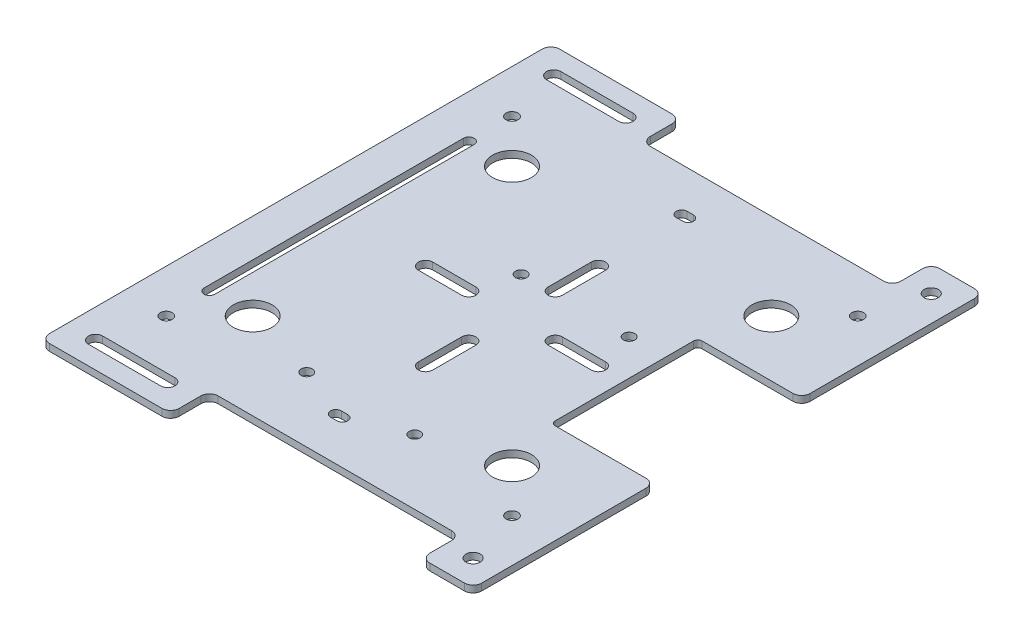
from build123d import *

# Parameters (mm, degrees)
BOSS_EXTRUDE1_DEPTH       = 1.5875
CUT_EXTRUDE1_DEPTH        = 5
SKETCH4_R                 = 1.375
CUT_EXTRUDE2_DEPTH        = 5
CUT_EXTRUDE4_DEPTH        = 5
CUT_EXTRUDE6_DEPTH        = 5
CIRPATTERN1_COUNT         = 4
CIRPATTERN4_COUNT         = 4
F_2_5MM_DOWEL_HOLE1_D     = 2.6
F_2_5MM_DOWEL_HOLE2_D     = 2.6
F_9_0_9_DIAMETER_HOLE1_D  = 9
CIRPATTERN5_COUNT         = 4
FILLET1_R                 = 2
F_2_5MM_DOWEL_HOLE3_D     = 3.3
F_2_5MM_DOWEL_SLOT1_DEPTH = 1.5875
SKETCH19_W                = 24
SKETCH19_H                = 34
CUT_EXTRUDE7_DEPTH        = 10
FILLET2_R                 = 2
FILLET3_R                 = 1


# Read off the part's stored shape, not the designer's step: Ø2.5mm Dowel Slot1
with BuildPart() as part:
    # Sketch2 → Boss-Extrude1 (new body)
    with BuildSketch(Plane(origin=(0, 0, 0), x_dir=(1, 0, 0), z_dir=(0, 1, 0))):
        Polygon((30, 0), (88, 0), (88, -9), (100, -9), (100, 0), (100, 100), (100, 109), (88, 109), (88, 100), (30, 100), (30, 109), (0, 109), (0, 100), (0, 0), (0, -9), (30, -9), align=None)
    extrude(amount=BOSS_EXTRUDE1_DEPTH)

    # Sketch3 → Cut-Extrude1 (cut)
    with BuildSketch(Plane(origin=(0, 1.5875, 0), x_dir=(1, 0, 0), z_dir=(0, 1, 0))):
        with BuildLine():
            Line((11.25, 80), (11.25, 20))
            ThreePointArc((11.25, 20), (10, 18.75), (8.75, 20))
            Line((8.75, 20), (8.75, 80))
            ThreePointArc((8.75, 80), (10, 81.25), (11.25, 80))
        make_face()
    extrude(amount=-CUT_EXTRUDE1_DEPTH, mode=Mode.SUBTRACT)

    # Sketch4 → Cut-Extrude2 (cut)
    with BuildSketch(Plane(origin=(0, 1.5875, 0), x_dir=(1, 0, 0), z_dir=(0, 1, 0))):
        with Locations(Location((10, 10, 0), (0, 0, 270))):
            Circle(SKETCH4_R)
    cut_extrude2 = extrude(amount=-CUT_EXTRUDE2_DEPTH, mode=Mode.SUBTRACT)

    # Sketch6 → Cut-Extrude4 (cut)
    with BuildSketch(Plane(origin=(0, 1.5875, 0), x_dir=(1, 0, 0), z_dir=(0, 1, 0))):
        with BuildLine():
            Line((49.25, 11.25), (50.75, 11.25))
            ThreePointArc((50.75, 11.25), (52, 10), (50.75, 8.75))
            Line((50.75, 8.75), (49.25, 8.75))
            ThreePointArc((49.25, 8.75), (48, 10), (49.25, 11.25))
        make_face()
    cut_extrude4 = extrude(amount=-CUT_EXTRUDE4_DEPTH, mode=Mode.SUBTRACT)

    # Sketch8 → Cut-Extrude6 (cut)
    with BuildSketch(Plane(origin=(0, 1.5875, 0), x_dir=(1, 0, 0), z_dir=(0, 1, 0))):
        with BuildLine():
            Line((30, 51.65), (40, 51.65))
            ThreePointArc((40, 51.65), (41.65, 50), (40, 48.35))
            Line((40, 48.35), (30, 48.35))
            ThreePointArc((30, 48.35), (28.35, 50), (30, 51.65))
        make_face()
    cut_extrude6 = extrude(amount=-CUT_EXTRUDE6_DEPTH, mode=Mode.SUBTRACT)

    # CirPattern1: Cut-Extrude6 ×4 about axis
    cirpattern1_axis = Axis((50, 0, -50), (0, 1, 0))
    for i in range(1, CIRPATTERN1_COUNT):
        add(cut_extrude6.rotate(cirpattern1_axis, i * 360 / CIRPATTERN1_COUNT), mode=Mode.SUBTRACT)

    # CirPattern4: Cut-Extrude2 ×4 about axis
    cirpattern4_axis = Axis((50, 0, -50), (0, 1, 0))
    for i in range(1, CIRPATTERN4_COUNT):
        add(cut_extrude2.rotate(cirpattern4_axis, i * 360 / CIRPATTERN4_COUNT), mode=Mode.SUBTRACT)

    # Mirror6: Cut-Extrude4 across plane
    add(cut_extrude4.mirror(Plane(origin=(0, 0, -50), x_dir=(1, 0, 0), z_dir=(0, 0, -1))), mode=Mode.SUBTRACT)

    # Ø2.5mm Dowel Hole1 (through all)
    with Locations(Plane(origin=(0, 1.5875, 0), x_dir=(1, 0, 0), z_dir=(0, 1, 0))):
        with Locations((62.5, 15), (37.5, 15)):
            Hole(F_2_5MM_DOWEL_HOLE1_D / 2)

    # Ø2.5mm Dowel Hole2 (through all)
    with Locations(Plane(origin=(0, 1.5875, 0), x_dir=(1, 0, 0), z_dir=(0, 1, 0))):
        with Locations((42.7, 59.4), (67.7, 59.4)):
            Hole(F_2_5MM_DOWEL_HOLE2_D / 2)

    # Ø9.0 (9) Diameter Hole1 (through all)
    with Locations(Plane(origin=(0, 1.5875, 0), x_dir=(1, 0, 0), z_dir=(0, 1, 0))):
        with Locations((80, 20)):
            f_9_0_9_diameter_hole1 = Hole(F_9_0_9_DIAMETER_HOLE1_D / 2)

    # CirPattern5: Ø9.0 (9) Diameter Hole1 ×4 about axis
    cirpattern5_axis = Axis((50, 0, -50), (0, 1, 0))
    for i in range(1, CIRPATTERN5_COUNT):
        add(f_9_0_9_diameter_hole1.rotate(cirpattern5_axis, i * 360 / CIRPATTERN5_COUNT), mode=Mode.SUBTRACT)

    # Fillet1
    fillet1_edges = [part.edges().sort_by_distance(p)[0] for p in [
        (30, 0.79375, 0),
        (30, 0.79375, 9),
        (0, 0.79375, 9),
        (0, 0.79375, -109),
        (30, 0.79375, -109),
        (30, 0.79375, -100),
        (88, 0.79375, -100),
        (88, 0.79375, -109),
        (100, 0.79375, -109),
        (100, 0.79375, 9),
        (88, 0.79375, 9),
        (88, 0.79375, 0),
    ]]
    fillet(fillet1_edges, radius=FILLET1_R)

    # Ø2.5mm Dowel Hole3 (through all)
    with Locations(Plane(origin=(0, 1.5875, 0), x_dir=(1, 0, 0), z_dir=(0, 1, 0))):
        with Locations((94, -3), (94, 103)):
            Hole(F_2_5MM_DOWEL_HOLE3_D / 2)

    # Ø2.5mm Dowel Slot1 outline → Ø2.5mm Dowel Slot1 (cut)
    with BuildSketch(Plane(origin=(0, 0, 0), x_dir=(1, 0, 0), z_dir=(0, 1, 0))):
        with BuildLine():
            Line((6.65, 101.35), (23.35, 101.35))
            ThreePointArc((23.35, 101.35), (25, 103), (23.35, 104.65))
            Line((23.35, 104.65), (6.65, 104.65))
            ThreePointArc((6.65, 104.65), (5, 103), (6.65, 101.35))
        make_face()
        with BuildLine():
            Line((6.65, -4.65), (23.35, -4.65))
            ThreePointArc((23.35, -4.65), (25, -3), (23.35, -1.35))
            Line((23.35, -1.35), (6.65, -1.35))
            ThreePointArc((6.65, -1.35), (5, -3), (6.65, -4.65))
        make_face()
    extrude(amount=F_2_5MM_DOWEL_SLOT1_DEPTH, mode=Mode.SUBTRACT)

    # Sketch19 → Cut-Extrude7 (cut)
    with BuildSketch(Plane(origin=(0, 1.5875, 0), x_dir=(1, 0, 0), z_dir=(0, 1, 0))):
        with Locations((88, 50)):
            Rectangle(SKETCH19_W, SKETCH19_H)
    extrude(amount=-CUT_EXTRUDE7_DEPTH, mode=Mode.SUBTRACT)

    # Fillet2
    fillet2_edges = [part.edges().sort_by_distance(p)[0] for p in [
        (100, 0.79375, -67),
        (100, 0.79375, -33),
    ]]
    fillet(fillet2_edges, radius=FILLET2_R)

    # Fillet3
    fillet3_edges = [part.edges().sort_by_distance(p)[0] for p in [
        (76, 0.79375, -33),
        (76, 0.79375, -67),
    ]]
    fillet(fillet3_edges, radius=FILLET3_R)


solid = part.part
